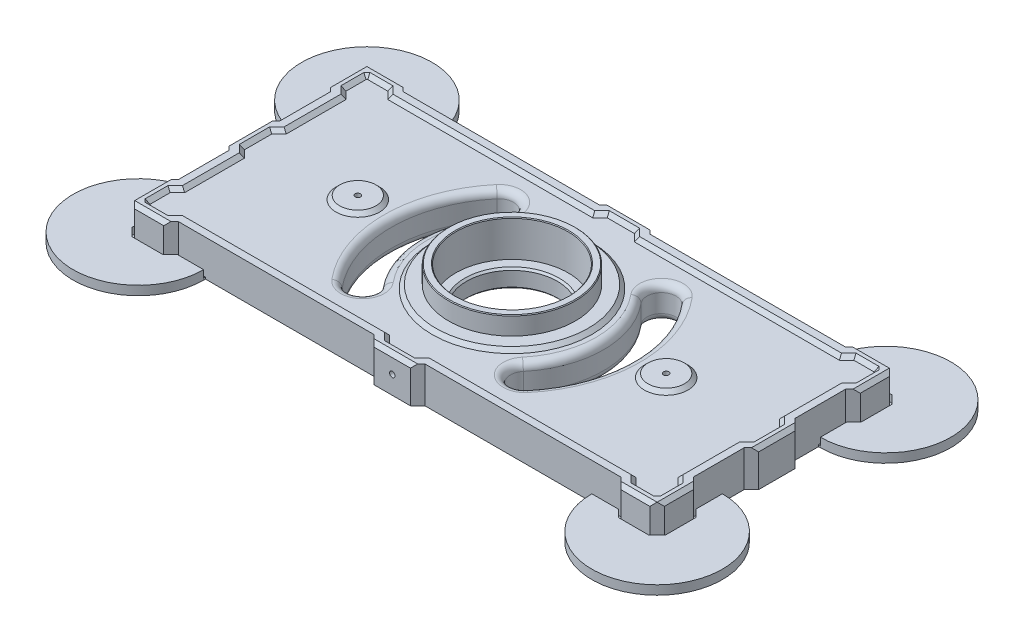
from build123d import *

# Parameters (mm, degrees)
BOSS_EXTRUDE1_DEPTH                      = 10
MIRROR1_DEPTH                            = 10
SKETCH2_R                                = 17.5
SKETCH2_R_2                              = 15.5
BOSS_EXTRUDE2_DEPTH                      = 5
CUT_EXTRUDE2_START                       = -5
SKETCH3_R                                = 15.5
CUT_EXTRUDE2_DEPTH                       = 5
SKETCH4_R                                = 12.5
CUT_EXTRUDE3_DEPTH                       = 81.734131568
CHAMFER2_SIZE                            = 0.2
CHAMFER4_SIZE                            = 0.5
SKETCH5_R                                = 5
SKETCH5_R_2                              = 21
CUT_EXTRUDE5_DEPTH                       = 1
CHAMFER6_SIZE                            = 1
SKETCH6_R                                = 0.75
CUT_EXTRUDE6_DEPTH                       = 7
SKETCH7_R                                = 0.75
CUT_EXTRUDE7_DEPTH                       = 7
CUT_EXTRUDE8_DEPTH                       = 151.432709209
CUT_EXTRUDE9_DEPTH                       = 100.548982918
CUT_EXTRUDE10_DEPTH                      = 81.616375508
FILLET3_R                                = 2
FILLET3_OF_MIRROR3_R                     = 2
SKETCH11_R                               = 0.75
CUT_EXTRUDE11_DEPTH                      = 5
BOSS_EXTRUDE3_DEPTH                      = 0.5
BOSS_EXTRUDE4_DEPTH                      = 2.5
MIRROR4_AT_THE_SECOND_PLANE_COPY_1_DEPTH = 0.5
MIRROR4_AT_THE_SECOND_PLANE_COPY_2_DEPTH = 2.5


# Read off the part's stored shape, not the designer's step: Mirror1
with BuildPart() as part:
    # Sketch1 → Boss-Extrude1 (new body)
    with BuildSketch(Plane(origin=(0, 0, 0), x_dir=(1, 0, 0), z_dir=(0, 1, 0))):
        Polygon((-73, 31), (-71, 33), (-63, 33), (-61, 31), (-7, 31), (-5, 33), (0, 33), (0, 0), (-73, 0), (-73, 5), (-71, 7), (-71, 21), (-73, 23), align=None)
    extrude(amount=BOSS_EXTRUDE1_DEPTH)

    # Mirror1 outline → Mirror1 (add)
    with BuildSketch(Plane(origin=(0, 0, 0), x_dir=(1, 0, 0), z_dir=(0, 1, 0))):
        Polygon((-73, 0), (-73, -5), (-71, -7), (-71, -21), (-73, -23), (-73, -31), (-71, -33), (-63, -33), (-61, -31), (-7, -31), (-5, -33), (5, -33), (7, -31), (61, -31), (63, -33), (71, -33), (73, -31), (73, -23), (71, -21), (71, -7), (73, -5), (73, 5), (71, 7), (71, 21), (73, 23), (73, 31), (71, 33), (63, 33), (61, 31), (7, 31), (5, 33), (0, 33), (0, 0), align=None)
    extrude(amount=MIRROR1_DEPTH)

    # Sketch2 → Boss-Extrude2 (add)
    with BuildSketch(Plane(origin=(0, 10, 0), x_dir=(1, 0, 0), z_dir=(0, 1, 0))):
        with Locations(Location((0, 0, 0), (0, 0, 90))):
            Circle(SKETCH2_R)
        with Locations(Location((0, 0, 0), (0, 0, 270))):
            Circle(SKETCH2_R_2, mode=Mode.SUBTRACT)
    extrude(amount=BOSS_EXTRUDE2_DEPTH)

    # Sketch3 → Cut-Extrude2 (cut)
    with BuildSketch(Plane(origin=(0, 10, 0), x_dir=(1, 0, 0), z_dir=(0, 1, 0)).offset(CUT_EXTRUDE2_START)):
        with Locations(Location((0, 0, 0), (0, 0, 270))):
            Circle(SKETCH3_R)
    extrude(amount=CUT_EXTRUDE2_DEPTH, mode=Mode.SUBTRACT)

    # Sketch4 → Cut-Extrude3 (cut, through all)
    with BuildSketch(Plane(origin=(0, 5, 0), x_dir=(1, 0, 0), z_dir=(0, 1, 0))):
        with Locations(Location((0, 0, 0), (0, 0, 270))):
            Circle(SKETCH4_R)
    extrude(amount=-CUT_EXTRUDE3_DEPTH, mode=Mode.SUBTRACT)

    # Chamfer2
    chamfer2_edges = [part.edges().sort_by_distance(p)[0] for p in [
        (0, 15, 17.5),
        (0, 15, -15.5),
    ]]
    chamfer(chamfer2_edges, length=CHAMFER2_SIZE)

    # Chamfer4
    chamfer4_edges = [part.edges().sort_by_distance(p)[0] for p in [
        (0, 0, -12.5),
        (0, 5, -12.5),
    ]]
    chamfer(chamfer4_edges, length=CHAMFER4_SIZE)

    # Sketch5 → Cut-Extrude5 (cut)
    with BuildSketch(Plane.XZ.offset(-10)):
        Polygon((71, 4.171572875), (69, 6.171572875), (69, 21.828427125), (71, 23.828427125), (71, 30.171572875), (70.171572875, 31), (63.828427125, 31), (61.828427125, 29), (6.171572875, 29), (4.171572875, 31), (-4.171572875, 31), (-6.171572875, 29), (-61.828427125, 29), (-63.828427125, 31), (-70.171572875, 31), (-71, 30.171572875), (-71, 23.828427125), (-69, 21.828427125), (-69, 6.171572875), (-71, 4.171572875), (-71, -4.171572875), (-69, -6.171572875), (-69, -21.828427125), (-71, -23.828427125), (-71, -30.171572875), (-70.171572875, -31), (-63.828427125, -31), (-61.828427125, -29), (-6.171572875, -29), (-4.171572875, -31), (4.171572875, -31), (6.171572875, -29), (61.828427125, -29), (63.828427125, -31), (70.171572875, -31), (71, -30.171572875), (71, -23.828427125), (69, -21.828427125), (69, -6.171572875), (71, -4.171572875), align=None)
        with Locations(Location((-42.5, 0, 0), (0, 0, 270))):
            Circle(SKETCH5_R, mode=Mode.SUBTRACT)
        with Locations(Location((42.5, 0, 0), (0, 0, 270))):
            Circle(SKETCH5_R, mode=Mode.SUBTRACT)
        with Locations(Location((0, 0, 0), (0, 0, 270))):
            Circle(SKETCH5_R_2, mode=Mode.SUBTRACT)
    extrude(amount=CUT_EXTRUDE5_DEPTH, mode=Mode.SUBTRACT)

    # Chamfer6
    chamfer6_edges = [part.edges().sort_by_distance(p)[0] for p in [
        (0, 9, 21),
        (67, 9, 31),
        (62.828427125, 9, 30),
        (34, 9, 29),
        (5.171572875, 9, 30),
        (0, 9, 31),
        (-5.171572875, 9, 30),
        (-34, 9, 29),
        (-62.828427125, 9, 30),
        (-67, 9, 31),
        (-71, 9, 27),
        (-70, 9, 22.828427125),
        (-69, 9, 14),
        (-70, 9, 5.171572875),
        (-71, 9, 0),
        (-70, 9, -5.171572875),
        (-69, 9, -14),
        (-70, 9, -22.828427125),
        (-71, 9, -27),
        (-67, 9, -31),
        (-62.828427125, 9, -30),
        (-34, 9, -29),
        (-5.171572875, 9, -30),
        (0, 9, -31),
        (5.171572875, 9, -30),
        (34, 9, -29),
        (62.828427125, 9, -30),
        (67, 9, -31),
        (71, 9, -27),
        (70, 9, -22.828427125),
        (69, 9, -14),
        (70, 9, -5.171572875),
        (71, 9, 0),
        (70, 9, 5.171572875),
        (69, 9, 14),
        (70, 9, 22.828427125),
        (71, 9, 27),
        (70.585786438, 9, 30.585786438),
        (-70.585786438, 9, 30.585786438),
        (-70.585786438, 9, -30.585786438),
        (70.585786438, 9, -30.585786438),
        (-42.5, 9, 5),
        (42.5, 9, 5),
    ]]
    chamfer(chamfer6_edges, length=CHAMFER6_SIZE - 0.0001)  # a hair under: the kernel refuses the full size

    # Sketch6 → Cut-Extrude6 (cut)
    with BuildSketch(Plane.XY.offset(33)):
        with Locations((0, 5)):
            Circle(SKETCH6_R)
    cut_extrude6 = extrude(amount=-CUT_EXTRUDE6_DEPTH, mode=Mode.SUBTRACT)

    # Mirror2: Cut-Extrude6 across plane
    add(cut_extrude6.mirror(Plane.XY), mode=Mode.SUBTRACT)

    # Sketch7 → Cut-Extrude7 (cut)
    with BuildSketch(Plane(origin=(0, 10, 0), x_dir=(1, 0, 0), z_dir=(0, 1, 0))):
        with Locations(Location((-42.5, 0, 0), (0, 0, 270))):
            Circle(SKETCH7_R)
        with Locations(Location((42.5, 0, 0), (0, 0, 270))):
            Circle(SKETCH7_R)
    extrude(amount=-CUT_EXTRUDE7_DEPTH, mode=Mode.SUBTRACT)

    # Sketch8 → Cut-Extrude8 (cut, through all)
    with BuildSketch(Plane.ZY.offset(73)):
        Polygon((-33, 9), (-32, 10), (-33, 10), align=None)
        Polygon((33, 10), (32, 10), (33, 9), align=None)
    extrude(amount=-CUT_EXTRUDE8_DEPTH, mode=Mode.SUBTRACT)

    # Sketch9 → Cut-Extrude9 (cut, through all)
    with BuildSketch(Plane.XY.offset(33)):
        Polygon((-73, 10), (-72, 10), (-73, 9), align=None)
        Polygon((72, 10), (73, 10), (73, 9), align=None)
    extrude(amount=-CUT_EXTRUDE9_DEPTH, mode=Mode.SUBTRACT)

    # Sketch10 → Cut-Extrude10 (cut, through all)
    with BuildSketch(Plane(origin=(0, 9, 0), x_dir=(1, 0, 0), z_dir=(0, 1, 0))):
        with BuildLine():
            ThreePointArc((-19.342622189, 16.230387145), (-19.835649522, 21.865715356), (-25.470977734, 21.372688022))
            ThreePointArc((-25.470977734, 21.372688022), (-33.25, 0), (-25.470977734, -21.372688022))
            ThreePointArc((-25.470977734, -21.372688022), (-19.835649522, -21.865715356), (-19.342622189, -16.230387145))
            ThreePointArc((-19.342622189, -16.230387145), (-25.25, 0), (-19.342622189, 16.230387145))
        make_face()
    cut_extrude10 = extrude(amount=-CUT_EXTRUDE10_DEPTH, mode=Mode.SUBTRACT)

    # Fillet3
    fillet3_edges = [part.edges().sort_by_distance(p)[0] for p in [
        (-33.25, 0, 0),
        (-19.835649522, 0, -21.865715356),
        (-25.25, 0, 0),
        (-19.835649522, 0, 21.865715356),
        (-33.25, 9, 0),
        (-19.835649522, 9, 21.865715356),
        (-25.25, 9, 0),
        (-19.835649522, 9, -21.865715356),
    ]]
    fillet(fillet3_edges, radius=FILLET3_R)

    # Mirror3: Cut-Extrude10 across plane
    add(cut_extrude10.mirror(Plane(origin=(0, 0, 0), x_dir=(0, 0, 1), z_dir=(1, 0, 0))), mode=Mode.SUBTRACT)

    # Fillet3 of Mirror3
    fillet3_of_mirror3_edges = [part.edges().sort_by_distance(p)[0] for p in [
        (33.25, 0, 0),
        (19.835649522, 0, -21.865715356),
        (25.25, 0, 0),
        (19.835649522, 0, 21.865715356),
        (33.25, 9, 0),
        (19.835649522, 9, 21.865715356),
        (25.25, 9, 0),
        (19.835649522, 9, -21.865715356),
    ]]
    fillet(fillet3_of_mirror3_edges, radius=FILLET3_OF_MIRROR3_R)

    # Sketch11 → Cut-Extrude11 (cut)
    with BuildSketch(Plane.XZ):
        with Locations(Location((0, 17.2, 0), (0, 0, 270))):
            Circle(SKETCH11_R)
        with Locations(Location((45.6, 10.2, 0), (0, 0, 270))):
            Circle(SKETCH11_R)
        with Locations(Location((45.6, -10.2, 0), (0, 0, 270))):
            Circle(SKETCH11_R)
        with Locations(Location((0, -17.2, 0), (0, 0, 270))):
            Circle(SKETCH11_R)
    extrude(amount=-CUT_EXTRUDE11_DEPTH, mode=Mode.SUBTRACT)

    # Sketch12 → Boss-Extrude3 (add)
    with BuildSketch(Plane.XZ):
        Polygon((53.5, 31), (53.5, 31.5), (60.792893219, 31.5), (62.792893219, 33.5), (71.207106781, 33.5), (73.5, 31.207106781), (73.5, 22.792893219), (71.5, 20.792893219), (71.5, 13.5), (71, 13.5), (71, 21), (73, 23), (73, 31), (71, 33), (63, 33), (61, 31), align=None)
    boss_extrude3 = extrude(amount=-BOSS_EXTRUDE3_DEPTH)

    # Sketch13 → Boss-Extrude4 (add)
    with BuildSketch(Plane.XZ):
        with BuildLine():
            Line((71.5, 13.5), (71.5, 20.792893219))
            Line((71.5, 20.792893219), (73.5, 22.792893219))
            Line((73.5, 22.792893219), (73.5, 31.207106781))
            Line((73.5, 31.207106781), (71.207106781, 33.5))
            Line((71.207106781, 33.5), (62.792893219, 33.5))
            Line((62.792893219, 33.5), (60.792893219, 31.5))
            Line((60.792893219, 31.5), (53.5, 31.5))
            ThreePointArc((53.5, 31.5), (84.227922061, 44.227922061), (71.5, 13.5))
        make_face()
    boss_extrude4 = extrude(amount=-BOSS_EXTRUDE4_DEPTH)

    # Mirror4: Boss-Extrude3, Boss-Extrude4 across plane
    add(boss_extrude3.mirror(Plane(origin=(0, 0, 0), x_dir=(0, 0, 1), z_dir=(1, 0, 0))))
    add(boss_extrude4.mirror(Plane(origin=(0, 0, 0), x_dir=(0, 0, 1), z_dir=(1, 0, 0))))

    # Mirror4 at the second plane: Boss-Extrude3, Boss-Extrude4 across plane
    add(boss_extrude3.mirror(Plane(origin=(0, 0, 0), x_dir=(1, 0, 0), z_dir=(0, 0, -1))))
    add(boss_extrude4.mirror(Plane(origin=(0, 0, 0), x_dir=(1, 0, 0), z_dir=(0, 0, -1))))

    # Mirror4 at the second plane copy 1 sketc → Mirror4 at the second plane copy 1 (add)
    with BuildSketch(Plane(origin=(0, 0, 0), x_dir=(-1, 0, 0), z_dir=(0, -1, 0))):
        Polygon((53.5, 31), (53.5, 31.5), (60.792893219, 31.5), (62.792893219, 33.5), (71.207106781, 33.5), (73.5, 31.207106781), (73.5, 22.792893219), (71.5, 20.792893219), (71.5, 13.5), (71, 13.5), (71, 21), (73, 23), (73, 31), (71, 33), (63, 33), (61, 31), align=None)
    extrude(amount=-MIRROR4_AT_THE_SECOND_PLANE_COPY_1_DEPTH)

    # Mirror4 at the second plane copy 2 sketc → Mirror4 at the second plane copy 2 (add)
    with BuildSketch(Plane(origin=(0, 0, 0), x_dir=(-1, 0, 0), z_dir=(0, -1, 0))):
        with BuildLine():
            Line((71.5, 13.5), (71.5, 20.792893219))
            Line((71.5, 20.792893219), (73.5, 22.792893219))
            Line((73.5, 22.792893219), (73.5, 31.207106781))
            Line((73.5, 31.207106781), (71.207106781, 33.5))
            Line((71.207106781, 33.5), (62.792893219, 33.5))
            Line((62.792893219, 33.5), (60.792893219, 31.5))
            Line((60.792893219, 31.5), (53.5, 31.5))
            ThreePointArc((53.5, 31.5), (84.227922061, 44.227922061), (71.5, 13.5))
        make_face()
    extrude(amount=-MIRROR4_AT_THE_SECOND_PLANE_COPY_2_DEPTH)


solid = part.part
